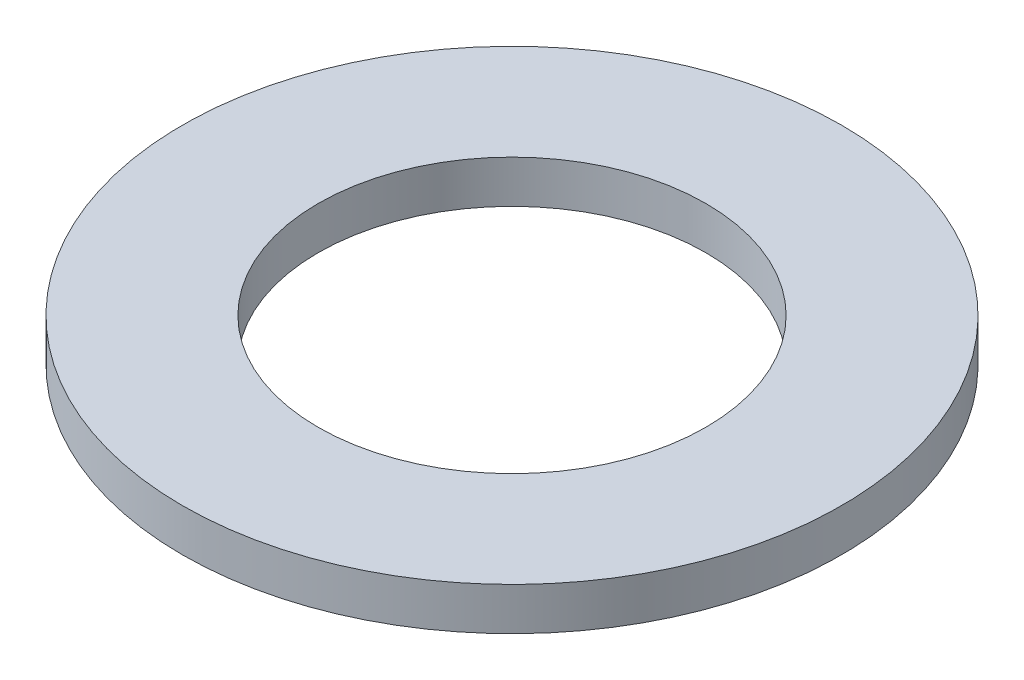
from build123d import *

# Parameters (mm, degrees)
SKETCH1_R           = 85
BOSS_EXTRUDE1_DEPTH = 11
SKETCH2_R           = 50
CUT_EXTRUDE1_DEPTH  = 121.710397232


with BuildPart() as part:
    # Sketch1 → Boss-Extrude1 (new body)
    with BuildSketch(Plane(origin=(0, 0, 0), x_dir=(1, 0, 0), z_dir=(0, 1, 0))):
        Circle(SKETCH1_R)
    extrude(amount=BOSS_EXTRUDE1_DEPTH)

    # Sketch2 → Cut-Extrude1 (cut, through all)
    with BuildSketch(Plane(origin=(0, 0, 0), x_dir=(1, 0, 0), z_dir=(0, 1, 0))):
        Circle(SKETCH2_R)
    extrude(amount=CUT_EXTRUDE1_DEPTH, mode=Mode.SUBTRACT)


solid = part.part
